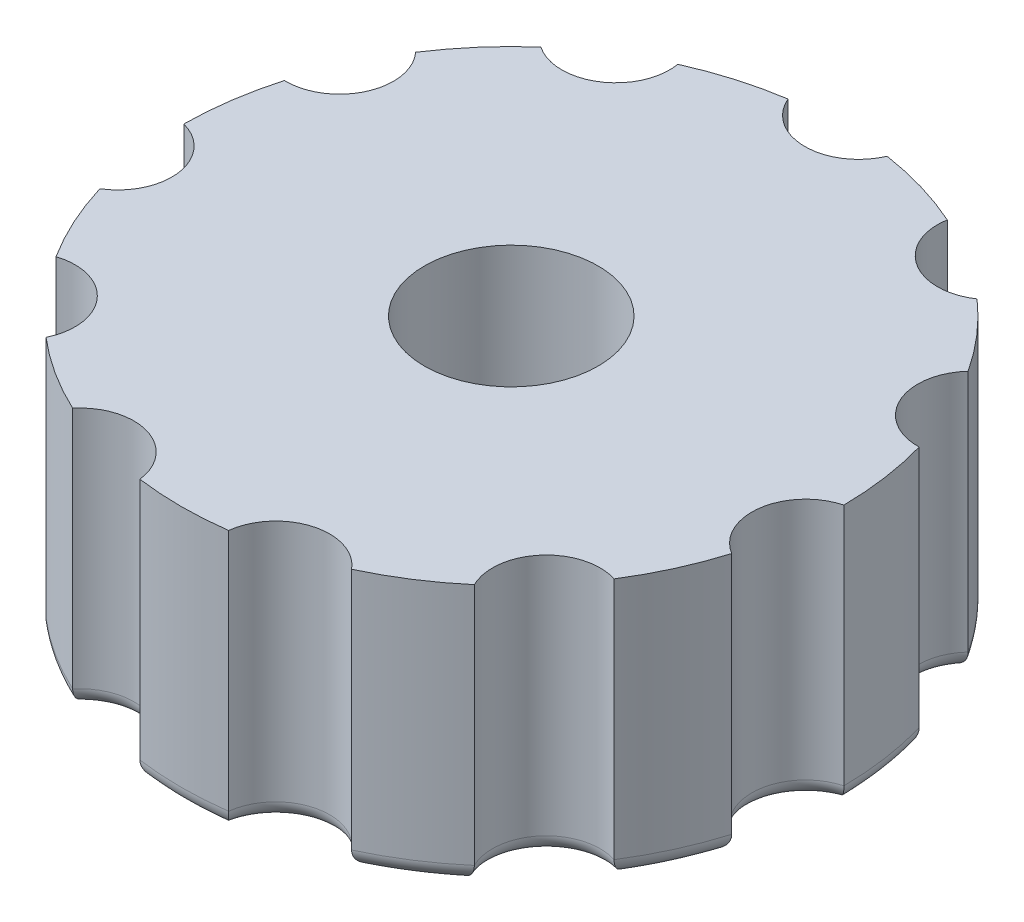
from build123d import *

# Parameters (mm, degrees)
SKETCH1_R           = 9.5
SKETCH1_R_2         = 2.5
BOSS_EXTRUDE1_DEPTH = 7.5
SKETCH1_3_R         = 2.5
BOSS_EXTRUDE2_DEPTH = 2
SKETCH1_4_R         = 1.55
CUT_EXTRUDE1_DEPTH  = 16.386682553
CIRPATTERN1_COUNT   = 11
FILLET1_R           = 0.5


with BuildPart() as part:
    # Sketch1 → Boss-Extrude1 (new body)
    with BuildSketch(Plane(origin=(0, 0, 0), x_dir=(1, 0, 0), z_dir=(0, 1, 0))):
        Circle(SKETCH1_R)
        Circle(SKETCH1_R_2, mode=Mode.SUBTRACT)
    extrude(amount=BOSS_EXTRUDE1_DEPTH)

    # Sketch1<3> → Boss-Extrude2 (add)
    with BuildSketch(Plane(origin=(0, 0, 0), x_dir=(1, 0, 0), z_dir=(0, 1, 0))):
        Circle(SKETCH1_3_R)
    extrude(amount=BOSS_EXTRUDE2_DEPTH)

    # Sketch1<4> → Cut-Extrude1 (cut, through all)
    with BuildSketch(Plane(origin=(0, 0, 0), x_dir=(1, 0, 0), z_dir=(0, 1, 0))):
        with Locations((0, 10)):
            Circle(SKETCH1_4_R)
    cut_extrude1 = extrude(amount=CUT_EXTRUDE1_DEPTH, mode=Mode.SUBTRACT)

    # CirPattern1: Cut-Extrude1 ×11 about axis
    cirpattern1_axis = Axis((0, 0, 0), (0, 1, 0))
    for i in range(1, CIRPATTERN1_COUNT):
        add(cut_extrude1.rotate(cirpattern1_axis, i * 360 / CIRPATTERN1_COUNT), mode=Mode.SUBTRACT)

    # Fillet1
    fillet1_edges = [part.edges().sort_by_distance(p)[0] for p in [
        (-9.403303698, 0, -1.351990964),
        (-8.363991184, 0, 1.202560383),
        (-8.641503956, 0, 3.946442624),
        (-6.386083903, 0, 5.533573202),
        (-5.136087766, 0, 7.991908562),
        (-2.380640105, 0, 8.107715627),
        (0, 0, 9.5),
        (2.380640105, 0, 8.107715627),
        (5.136087766, 0, 7.991908562),
        (6.386083903, 0, 5.533573202),
        (8.641503956, 0, 3.946442624),
        (0, 0, -8.45),
        (-2.67645929, 0, -9.115183249),
        (-4.568414907, 0, -7.108592352),
        (-7.179620956, 0, -6.221176972),
        (-7.686390361, 0, -3.51025686),
        (8.363991184, 0, 1.202560383),
        (9.403303698, 0, -1.351990964),
        (7.686390361, 0, -3.51025686),
        (7.179620956, 0, -6.221176972),
        (4.568414907, 0, -7.108592352),
        (2.67645929, 0, -9.115183249),
    ]]
    fillet(fillet1_edges, radius=FILLET1_R)


solid = part.part
